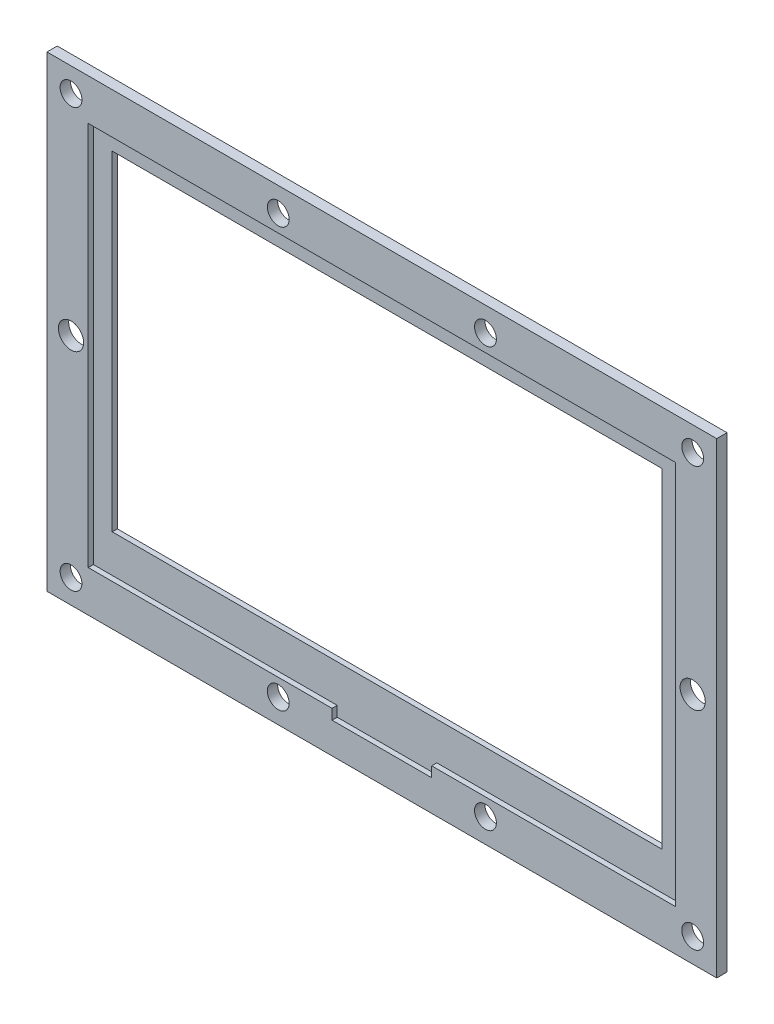
from build123d import *

# Parameters (mm, degrees)
SKETCH1_W           = 195
SKETCH1_H           = 136
SKETCH1_W_2         = 160
SKETCH1_H_2         = 96
BOSS_EXTRUDE1_DEPTH = 1.5
SKETCH1_3_W         = 195
SKETCH1_3_H         = 136
BOSS_EXTRUDE2_DEPTH = 1.5
SKETCH2_R           = 3.175
SKETCH2_R_2         = 3.673722566
CUT_EXTRUDE1_DEPTH  = 119.908578328


with BuildPart() as part:
    # Sketch1 → Boss-Extrude1 (new body)
    with BuildSketch(Plane.XY):
        Rectangle(SKETCH1_W, SKETCH1_H)
        with Locations((0, 3)):
            Rectangle(SKETCH1_W_2, SKETCH1_H_2, mode=Mode.SUBTRACT)
    extrude(amount=-BOSS_EXTRUDE1_DEPTH)

    # Sketch1<3> → Boss-Extrude2 (add)
    with BuildSketch(Plane.XY):
        Rectangle(SKETCH1_3_W, SKETCH1_3_H)
        Polygon((85.5, 56), (85.5, -56), (14.5, -56), (14.5, -59), (-14.5, -59), (-14.5, -56), (-85.5, -56), (-85.5, 56), align=None, mode=Mode.SUBTRACT)
    extrude(amount=BOSS_EXTRUDE2_DEPTH)

    # Sketch2 → Cut-Extrude1 (cut, through all)
    with BuildSketch(Plane.XY.offset(1.5)):
        with Locations((-90.5, 61)):
            Circle(SKETCH2_R)
        with Locations((90.5, 61)):
            Circle(SKETCH2_R)
        with Locations((90.5, -61)):
            Circle(SKETCH2_R)
        with Locations((-90.5, -61)):
            Circle(SKETCH2_R)
        with Locations((-30.166666667, -61)):
            Circle(SKETCH2_R)
        with Locations((30.166666667, -61)):
            Circle(SKETCH2_R)
        with Locations((90.5, 0)):
            Circle(SKETCH2_R_2)
        with Locations((-30.166666667, 61)):
            Circle(SKETCH2_R)
        with Locations((30.166666667, 61)):
            Circle(SKETCH2_R)
        with Locations((-90.5, 0)):
            Circle(SKETCH2_R_2)
    extrude(amount=-CUT_EXTRUDE1_DEPTH, mode=Mode.SUBTRACT)


solid = part.part
